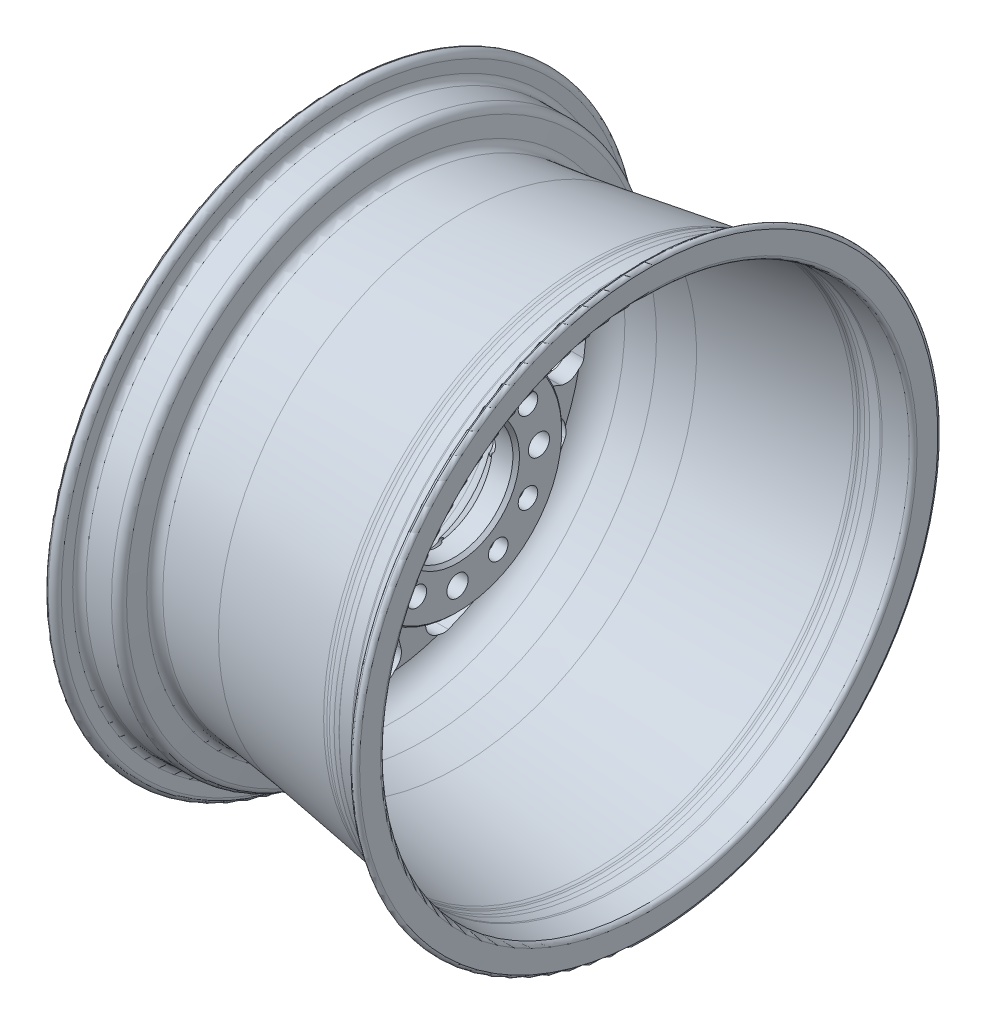
from build123d import *

# Parameters (mm, degrees)
CUT_EXTRUDE1_DEPTH = 281.10144831
CIRPATTERN1_COUNT  = 12


with BuildPart() as part:
    # Sketch1 → Revolve1 (revolve)
    with BuildSketch(Plane.XY, mode=Mode.PRIVATE) as revolve1_sk:
        with BuildLine():
            Line((0.036816631, 178.325), (0.036816631, 165.984917143))
            ThreePointArc((0.036816631, 165.984917143), (1.087707283, 163.282556312), (3.68819366, 162.00013835))
            Line((3.68819366, 162.00013835), (23.24586547, 160.289063782))
            ThreePointArc((23.24586547, 160.289063782), (26.279921379, 158.909378628), (27.774466226, 155.930224036))
            Line((27.774466226, 155.930224036), (29.069731252, 145.660674702))
            ThreePointArc((29.069731252, 145.660674702), (30.965106504, 142.336187735), (34.656106476, 141.325653149))
            Line((34.656106476, 141.325653149), (51.872287708, 143.497074379))
            Line((51.872287708, 143.497074379), (72.879167128, 147.064670738))
            Line((72.879167128, 147.064670738), (156.379373256, 160.042606432))
            ThreePointArc((156.379373256, 160.042606432), (157.357581286, 160.250881142), (158.306640372, 160.566406346))
            Line((158.306640372, 160.566406346), (159.336314727, 160.973566259))
            ThreePointArc((159.336314727, 160.973566259), (160.56407364, 161.329829734), (161.836816631, 161.45))
            Line((161.836816631, 161.45), (164.781189288, 161.45))
            Line((164.781189288, 161.45), (171.833448399, 160.888687484))
            ThreePointArc((171.833448399, 160.888687484), (172.407960779, 160.866987738), (172.982285362, 160.893191299))
            Line((172.982285362, 160.893191299), (188.354705988, 162.238103835))
            ThreePointArc((188.354705988, 162.238103835), (189.980009973, 163.039615061), (190.636816631, 164.72859058))
            Line((190.636816631, 164.72859058), (190.636816631, 177.487376234))
            ThreePointArc((190.636816631, 177.487376234), (189.780905494, 179.153705069), (187.927888059, 179.42859058))
            ThreePointArc((187.927888059, 179.42859058), (185.544526461, 177.661001024), (184.636816631, 174.835961517))
            Line((184.636816631, 174.835961517), (184.636816631, 172.154557585))
            ThreePointArc((184.636816631, 172.154557585), (182.535035325, 166.749835924), (177.334062573, 164.185))
            Line((177.334062573, 164.185), (172.729533708, 163.782155923))
            ThreePointArc((172.729533708, 163.782155923), (172.396591921, 163.766965453), (172.063541266, 163.779545016))
            Line((172.063541266, 163.779545016), (164.955830182, 164.345271137))
            ThreePointArc((164.955830182, 164.345271137), (164.896370362, 164.348817318), (164.836816631, 164.35))
            Line((164.836816631, 164.35), (161.836816631, 164.35))
            ThreePointArc((161.836816631, 164.35), (160.021286189, 164.178580651), (158.26992421, 163.670381281))
            Line((158.26992421, 163.670381281), (155.558882363, 162.598365109))
            ThreePointArc((155.558882363, 162.598365109), (154.31794092, 162.208731962), (153.033796234, 162.002038757))
            Line((153.033796234, 162.002038757), (76.636816631, 150.128114913))
            Line((76.636816631, 150.128114913), (51.436816631, 146.949720457))
            Line((51.436816631, 146.949720457), (37.524460525, 145.195))
            ThreePointArc((37.524460525, 145.195), (33.833460553, 146.205534585), (31.938085301, 149.530021553))
            Line((31.938085301, 149.530021553), (30.556091325, 160.487204076))
            ThreePointArc((30.556091325, 160.487204076), (28.916135806, 163.58566169), (25.636816631, 164.825))
            Line((25.636816631, 164.825), (9.836816631, 164.825))
            ThreePointArc((9.836816631, 164.825), (7.008389506, 165.996572875), (5.836816631, 168.825))
            Line((5.836816631, 168.825), (5.836816631, 175.825))
            ThreePointArc((5.836816631, 175.825), (4.665243755, 178.653427125), (1.836816631, 179.825))
            Line((1.836816631, 179.825), (1.536816631, 179.825))
            ThreePointArc((1.536816631, 179.825), (0.476156459, 179.385660172), (0.036816631, 178.325))
        make_face()
    revolve(revolve1_sk.sketch.rotate(Axis((0, 0, 0), (1, 0, 0)), 90), axis=Axis((0, 0, 0), (1, 0, 0)))

    # Sketch2 → Revolve2 (revolve)
    with BuildSketch(Plane(origin=(0, 0, 0), x_dir=(1, 0, 0), z_dir=(0, 1, 0)), mode=Mode.PRIVATE) as revolve2_sk:
        with BuildLine():
            Line((58.736816631, 36), (71.236816631, 36))
            Line((71.236816631, 36), (73.236816631, 38))
            Line((73.236816631, 38), (73.236816631, 64))
            Line((73.236816631, 64), (72.236816631, 65))
            Line((72.236816631, 65), (69.568336953, 65))
            ThreePointArc((69.568336953, 65), (68.52769829, 65.109491727), (67.532636156, 65.433171531))
            Line((67.532636156, 65.433171531), (32.413757737, 81.087696167))
            ThreePointArc((32.413757737, 81.087696167), (23.978252199, 88.206726392), (20.603907332, 98.716347781))
            Line((20.603907332, 98.716347781), (19.612551386, 130.586528075))
            ThreePointArc((19.612551386, 130.586528075), (25.819323268, 137.79817365), (34.656106476, 141.325653149))
            ThreePointArc((34.656106476, 141.325653149), (30.965106504, 142.336187735), (29.069731252, 145.660674702))
            Line((29.069731252, 145.660674702), (28.076097112, 153.538734102))
            ThreePointArc((28.076097112, 153.538734102), (27.058208015, 150.6293408), (24.730168029, 148.609217678))
            ThreePointArc((24.730168029, 148.609217678), (15.442219447, 141.545622882), (9.542551386, 131.478136748))
            Line((9.542551386, 131.478136748), (5.711253992, 88.206726392))
            ThreePointArc((5.711253992, 88.206726392), (8.329942999, 76.4131864), (17.261989285, 68.279081239))
            Line((17.261989285, 68.279081239), (34.318997886, 60.417818745))
            ThreePointArc((34.318997886, 60.417818745), (42.520979923, 54.701982037), (48.236816631, 46.5))
            Line((48.236816631, 46.5), (58.736816631, 36))
        make_face()
    revolve(revolve2_sk.sketch.rotate(Axis((0, 0, 0), (1, 0, 0)), 180), axis=Axis((0, 0, 0), (1, 0, 0)))

    # Sketch4 → Cut-Extrude1 (cut, through all)
    with BuildSketch(Plane(origin=(73.236816631, 0, 0), x_dir=(0, 0, -1), z_dir=(1, 0, 0))):
        with BuildLine():
            Line((-33.720034912, -115.044368626), (-30.338273122, -85.12036873))
            ThreePointArc((-30.338273122, -85.12036873), (-32.057893941, -75.012699007), (-38.899972287, -67.376728414))
            ThreePointArc((-38.899972287, -67.376728414), (-48.933955976, -65.269300048), (-58.547265139, -68.833899595))
            Line((-58.547265139, -68.833899595), (-82.771328337, -86.724591163))
            ThreePointArc((-82.771328337, -86.724591163), (-86.82789218, -94.543060344), (-83.12801219, -102.536498815))
            ThreePointArc((-83.12801219, -102.536498815), (-66, -114.3153533), (-47.235206694, -123.259219731))
            ThreePointArc((-47.235206694, -123.259219731), (-38.462745919, -122.466690556), (-33.720034912, -115.044368626))
        make_face()
        with BuildLine():
            ThreePointArc((-116.491363248, -28.319777463), (-125.290638099, -27.923630213), (-130.363218884, -20.722720915))
            ThreePointArc((-130.363218884, -20.722720915), (-132, 0), (-130.363218884, 20.722720915))
            ThreePointArc((-130.363218884, 20.722720915), (-125.290638099, 27.923630213), (-116.491363248, 28.319777463))
            Line((-116.491363248, 28.319777463), (-88.88553826, 16.286469135))
            ThreePointArc((-88.88553826, 16.286469135), (-80.991849916, 9.743398959), (-77.799944574, 0))
            ThreePointArc((-77.799944574, 0), (-80.991849916, -9.743398959), (-88.88553826, -16.286469135))
            Line((-88.88553826, -16.286469135), (-116.491363248, -28.319777463))
        make_face()
        with BuildLine():
            Line((82.771328337, -86.724591163), (58.547265139, -68.833899595))
            ThreePointArc((58.547265139, -68.833899595), (48.933955976, -65.269300048), (38.899972287, -67.376728414))
            ThreePointArc((38.899972287, -67.376728414), (32.057893941, -75.012699007), (30.338273122, -85.12036873))
            Line((30.338273122, -85.12036873), (33.720034912, -115.044368626))
            ThreePointArc((33.720034912, -115.044368626), (38.462745919, -122.466690556), (47.235206694, -123.259219731))
            ThreePointArc((47.235206694, -123.259219731), (66, -114.3153533), (83.12801219, -102.536498815))
            ThreePointArc((83.12801219, -102.536498815), (86.82789218, -94.543060344), (82.771328337, -86.724591163))
        make_face()
        with BuildLine():
            Line((116.491363248, 28.319777463), (88.88553826, 16.286469135))
            ThreePointArc((88.88553826, 16.286469135), (80.991849916, 9.743398959), (77.799944574, 0))
            ThreePointArc((77.799944574, 0), (80.991849916, -9.743398959), (88.88553826, -16.286469135))
            Line((88.88553826, -16.286469135), (116.491363248, -28.319777463))
            ThreePointArc((116.491363248, -28.319777463), (125.290638099, -27.923630213), (130.363218884, -20.722720915))
            ThreePointArc((130.363218884, -20.722720915), (132, 0), (130.363218884, 20.722720915))
            ThreePointArc((130.363218884, 20.722720915), (125.290638099, 27.923630213), (116.491363248, 28.319777463))
        make_face()
        with BuildLine():
            Line((33.720034912, 115.044368626), (30.338273122, 85.12036873))
            ThreePointArc((30.338273122, 85.12036873), (32.057893941, 75.012699007), (38.899972287, 67.376728414))
            ThreePointArc((38.899972287, 67.376728414), (48.933955976, 65.269300048), (58.547265139, 68.833899595))
            Line((58.547265139, 68.833899595), (82.771328337, 86.724591163))
            ThreePointArc((82.771328337, 86.724591163), (86.82789218, 94.543060344), (83.12801219, 102.536498815))
            ThreePointArc((83.12801219, 102.536498815), (66, 114.3153533), (47.235206694, 123.259219731))
            ThreePointArc((47.235206694, 123.259219731), (38.462745919, 122.466690556), (33.720034912, 115.044368626))
        make_face()
        with BuildLine():
            Line((-82.771328337, 86.724591163), (-58.547265139, 68.833899595))
            ThreePointArc((-58.547265139, 68.833899595), (-48.933955976, 65.269300048), (-38.899972287, 67.376728414))
            ThreePointArc((-38.899972287, 67.376728414), (-32.057893941, 75.012699007), (-30.338273122, 85.12036873))
            Line((-30.338273122, 85.12036873), (-33.720034912, 115.044368626))
            ThreePointArc((-33.720034912, 115.044368626), (-38.462745919, 122.466690556), (-47.235206694, 123.259219731))
            ThreePointArc((-47.235206694, 123.259219731), (-66, 114.3153533), (-83.12801219, 102.536498815))
            ThreePointArc((-83.12801219, 102.536498815), (-86.82789218, 94.543060344), (-82.771328337, 86.724591163))
        make_face()
        with BuildLine():
            ThreePointArc((-80.054093095, -34.94289247), (-68.715878193, -39.673130772), (-70.288479109, -51.857432062))
            Line((-70.288479109, -51.857432062), (-93.798173108, -75.607349706))
            ThreePointArc((-93.798173108, -75.607349706), (-101.820961224, -78.530286307), (-109.176000964, -74.192997065))
            ThreePointArc((-109.176000964, -74.192997065), (-114.3153533, -66), (-118.841020723, -57.452691786))
            ThreePointArc((-118.841020723, -57.452691786), (-118.91970352, -48.914395905), (-112.376972112, -43.427925887))
            Line((-112.376972112, -43.427925887), (-80.054093095, -34.94289247))
        make_face()
        with BuildLine():
            ThreePointArc((-112.376972112, 43.427925887), (-118.91970352, 48.914395905), (-118.841020723, 57.452691786))
            ThreePointArc((-118.841020723, 57.452691786), (-114.3153533, 66), (-109.176000964, 74.192997065))
            ThreePointArc((-109.176000964, 74.192997065), (-101.820961224, 78.530286307), (-93.798173108, 75.607349706))
            Line((-93.798173108, 75.607349706), (-70.288479109, 51.857432062))
            ThreePointArc((-70.288479109, 51.857432062), (-68.715878193, 39.673130772), (-80.054093095, 34.94289247))
            Line((-80.054093095, 34.94289247), (-112.376972112, 43.427925887))
        make_face()
        with BuildLine():
            ThreePointArc((-18.578799004, 119.035275593), (-17.098742296, 127.444682211), (-9.665019759, 131.645688851))
            ThreePointArc((-9.665019759, 131.645688851), (0, 132), (9.665019759, 131.645688851))
            ThreePointArc((9.665019759, 131.645688851), (17.098742296, 127.444682211), (18.578799004, 119.035275593))
            Line((18.578799004, 119.035275593), (9.765613987, 86.800324532))
            ThreePointArc((9.765613987, 86.800324532), (0, 79.346261545), (-9.765613987, 86.800324532))
            Line((-9.765613987, 86.800324532), (-18.578799004, 119.035275593))
        make_face()
        with BuildLine():
            ThreePointArc((93.798173108, 75.607349706), (101.820961224, 78.530286307), (109.176000964, 74.192997065))
            ThreePointArc((109.176000964, 74.192997065), (114.3153533, 66), (118.841020723, 57.452691786))
            ThreePointArc((118.841020723, 57.452691786), (118.91970352, 48.914395905), (112.376972112, 43.427925887))
            Line((112.376972112, 43.427925887), (80.054093095, 34.94289247))
            ThreePointArc((80.054093095, 34.94289247), (68.715878193, 39.673130772), (70.288479109, 51.857432062))
            Line((70.288479109, 51.857432062), (93.798173108, 75.607349706))
        make_face()
        with BuildLine():
            ThreePointArc((112.376972112, -43.427925887), (118.91970352, -48.914395905), (118.841020723, -57.452691786))
            ThreePointArc((118.841020723, -57.452691786), (114.3153533, -66), (109.176000964, -74.192997065))
            ThreePointArc((109.176000964, -74.192997065), (101.820961224, -78.530286307), (93.798173108, -75.607349706))
            Line((93.798173108, -75.607349706), (70.288479109, -51.857432062))
            ThreePointArc((70.288479109, -51.857432062), (68.715878193, -39.673130772), (80.054093095, -34.94289247))
            Line((80.054093095, -34.94289247), (112.376972112, -43.427925887))
        make_face()
        with BuildLine():
            ThreePointArc((18.578799004, -119.035275593), (17.098742296, -127.444682211), (9.665019759, -131.645688851))
            ThreePointArc((9.665019759, -131.645688851), (0, -132), (-9.665019759, -131.645688851))
            ThreePointArc((-9.665019759, -131.645688851), (-17.098742296, -127.444682211), (-18.578799004, -119.035275593))
            Line((-18.578799004, -119.035275593), (-9.765613987, -86.800324532))
            ThreePointArc((-9.765613987, -86.800324532), (0, -79.346261545), (9.765613987, -86.800324532))
            Line((9.765613987, -86.800324532), (18.578799004, -119.035275593))
        make_face()
    extrude(amount=-CUT_EXTRUDE1_DEPTH, mode=Mode.SUBTRACT)

    # Sketch6 → Ø12.0mm Dowel Hole1 (revolve, cut)
    with BuildSketch(Plane(origin=(73.236816631, 49.959983987, 0), x_dir=(0, 0, -1), z_dir=(0, 1, 0))):
        Polygon((0, 0), (0, 11.605163714), (6, 8), (6, 0), align=None)
    f_12_0mm_dowel_hole1 = revolve(axis=Axis((79.586816631, 49.959983987, 0), (-1, 0, 0)), mode=Mode.SUBTRACT)

    # CirPattern1: Ø12.0mm Dowel Hole1 ×12 about axis
    cirpattern1_axis = Axis((0, 0, 0), (1, 0, 0))
    for i in range(1, CIRPATTERN1_COUNT):
        add(f_12_0mm_dowel_hole1.rotate(cirpattern1_axis, i * 360 / CIRPATTERN1_COUNT), mode=Mode.SUBTRACT)

    # Fillet2: read off the stored shape, not the designer's step
    # Fillet2 outline → Fillet2 (revolve, cut)
    with BuildSketch(Plane.YX.offset(-50)):
        with BuildLine():
            Line((15, 24.376791984), (15, 58.736816631))
            ThreePointArc((15, 58.736816631), (14.414213562, 60.151030193), (13, 60.736816631))
            Line((13, 60.736816631), (8.81, 60.736816631))
            Line((8.81, 60.736816631), (8.006152423, 63.736816631))
            Line((8.006152423, 63.736816631), (6.5, 63.736816631))
            Line((6.5, 63.736816631), (6.5, 73.236816631))
            Line((6.5, 73.236816631), (0, 73.236816631))
            Line((0, 73.236816631), (0, 24.376791984))
            Line((0, 24.376791984), (15, 24.376791984))
        make_face()
    revolve(axis=Axis((0, 0, 50), (1, 0, 0)), mode=Mode.SUBTRACT)

    # Fillet2 2 outline → Fillet2 2 (revolve, cut)
    with BuildSketch(Plane(origin=(0, -50, 0), x_dir=(0, 1, 0), z_dir=(0, 0, -1))):
        with BuildLine():
            Line((13, 60.736816631), (8.81, 60.736816631))
            Line((8.81, 60.736816631), (8.006152423, 63.736816631))
            Line((8.006152423, 63.736816631), (6.5, 63.736816631))
            Line((6.5, 63.736816631), (6.5, 73.236816631))
            Line((6.5, 73.236816631), (0, 73.236816631))
            Line((0, 73.236816631), (0, 24.375839945))
            Line((0, 24.375839945), (15, 24.375839945))
            Line((15, 24.375839945), (15, 58.736816631))
            ThreePointArc((15, 58.736816631), (14.414213562, 60.151030193), (13, 60.736816631))
        make_face()
    revolve(axis=Axis((0, -50, 0), (1, 0, 0)), mode=Mode.SUBTRACT)

    # Fillet2 3 outline → Fillet2 3 (revolve, cut)
    with BuildSketch(Plane.YX.offset(50)):
        with BuildLine():
            Line((13, 60.736816631), (8.81, 60.736816631))
            Line((8.81, 60.736816631), (8.006152423, 63.736816631))
            Line((8.006152423, 63.736816631), (6.5, 63.736816631))
            Line((6.5, 63.736816631), (6.5, 73.236816631))
            Line((6.5, 73.236816631), (0, 73.236816631))
            Line((0, 73.236816631), (0, 24.375839945))
            Line((0, 24.375839945), (15, 24.375839945))
            Line((15, 24.375839945), (15, 58.736816631))
            ThreePointArc((15, 58.736816631), (14.414213562, 60.151030193), (13, 60.736816631))
        make_face()
    revolve(axis=Axis((0, 0, -50), (1, 0, 0)), mode=Mode.SUBTRACT)

    # Fillet2 4 outline → Fillet2 4 (revolve, cut)
    with BuildSketch(Plane(origin=(0, 50, 0), x_dir=(0, 1, 0), z_dir=(0, 0, -1))):
        with BuildLine():
            Line((13, 60.736816631), (8.81, 60.736816631))
            Line((8.81, 60.736816631), (8.006152423, 63.736816631))
            Line((8.006152423, 63.736816631), (6.5, 63.736816631))
            Line((6.5, 63.736816631), (6.5, 73.236816631))
            Line((6.5, 73.236816631), (0, 73.236816631))
            Line((0, 73.236816631), (0, 24.375839945))
            Line((0, 24.375839945), (15, 24.375839945))
            Line((15, 24.375839945), (15, 58.736816631))
            ThreePointArc((15, 58.736816631), (14.414213562, 60.151030193), (13, 60.736816631))
        make_face()
    revolve(axis=Axis((0, 50, 0), (1, 0, 0)), mode=Mode.SUBTRACT)


solid = part.part
